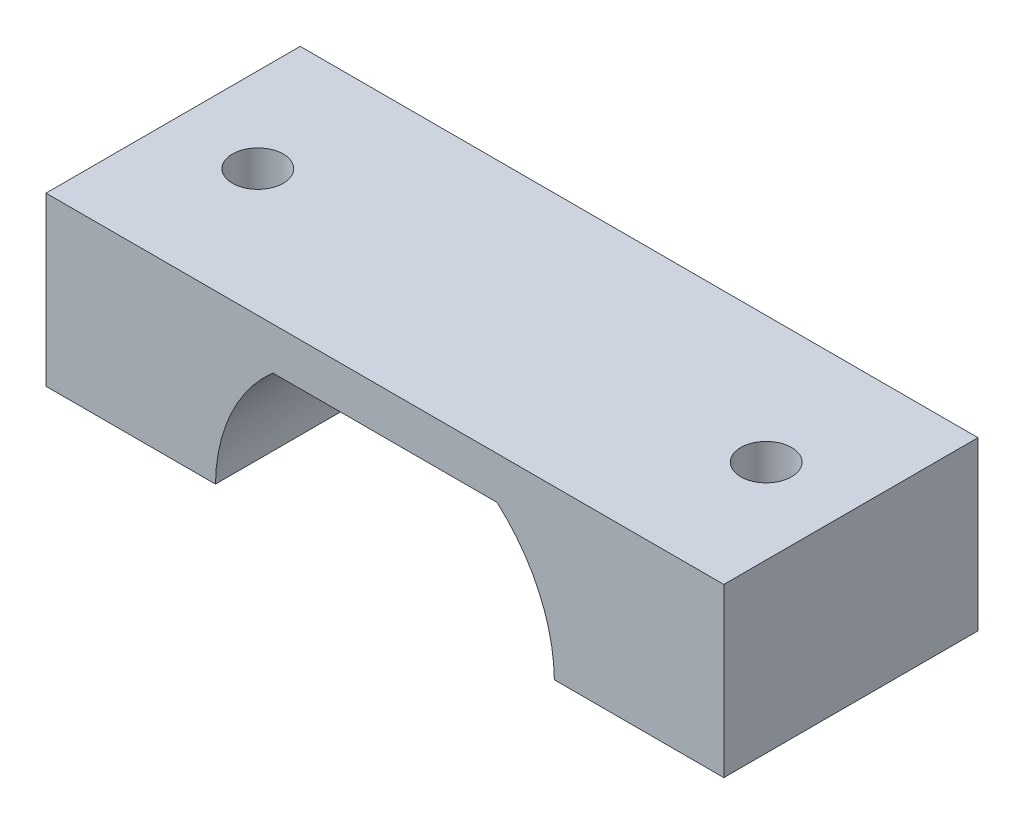
from build123d import *

# Parameters (mm, degrees)
MOTOR_CLAMP_OUTLINE_SOLID_DEPTH     = 7.5
MOTOR_CLAMP_MOUNTING_HOLES_SKETCH_R = 1.5
MOTOR_CLAMP_MOUNTING_HOLE_CUT_DEPTH = 24.532225245


with BuildPart() as part:
    # Motor Clamp Outline Sketch → Motor Clamp Outline Solid (new, symmetric)
    with BuildSketch(Plane.XY):
        with BuildLine():
            Line((-20, 0.125), (-9.999218719, 0.125))
            ThreePointArc((-9.999218719, 0.125), (-9.088484887, 4.171263892), (-6.614378278, 7.5))
            Line((-6.614378278, 7.5), (6.614378278, 7.5))
            ThreePointArc((6.614378278, 7.5), (9.088484887, 4.171263892), (9.999218719, 0.125))
            Line((9.999218719, 0.125), (20, 0.125))
            Line((20, 0.125), (20, 10))
            Line((20, 10), (-20, 10))
            Line((-20, 10), (-20, 0.125))
        make_face()
    extrude(amount=MOTOR_CLAMP_OUTLINE_SOLID_DEPTH, both=True)

    # Motor Clamp Mounting Holes Sketch → Motor Clamp Mounting Hole Cut (cut, through all)
    with BuildSketch(Plane(origin=(0, 10, 0), x_dir=(1, 0, 0), z_dir=(0, 1, 0))):
        with Locations((-15, 0)):
            Circle(MOTOR_CLAMP_MOUNTING_HOLES_SKETCH_R)
        with Locations((15, 0)):
            Circle(MOTOR_CLAMP_MOUNTING_HOLES_SKETCH_R)
    extrude(amount=-MOTOR_CLAMP_MOUNTING_HOLE_CUT_DEPTH, mode=Mode.SUBTRACT)


solid = part.part
